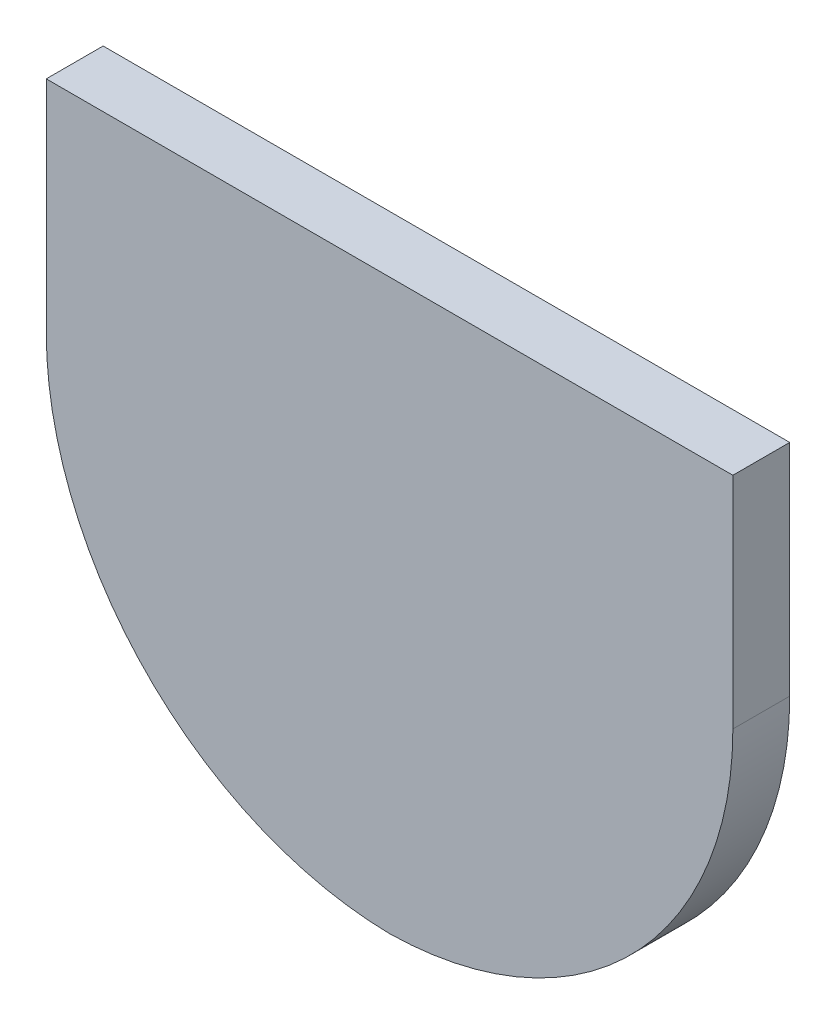
from build123d import *

# Parameters (mm, degrees)
SKETCH_1_W      = 26.56
SKETCH_1_H      = 22
EXTRUDE_1_DEPTH = 2.2
FILLET_1_R      = 13.5


with BuildPart() as part:
    # Эскиз1 → Бобышка-Вытянуть1 (new body)
    with BuildSketch(Plane.XY):
        with Locations((-4.253421702, 0.2)):
            Rectangle(SKETCH_1_W, SKETCH_1_H)
    extrude(amount=EXTRUDE_1_DEPTH)

    # Скругление1
    # the kernel refuses this fillet: 13.5 mm, written as the material it takes off along each edge
    with BuildSketch(Plane(origin=(9.026578298, -10.8, -33.75), x_dir=(0, 1, 0), z_dir=(0, 0, 1)), Plane(origin=(-17.533421702, -10.8, -33.75), x_dir=(1, 0, 0), z_dir=(0, 0, 1))) as fillet_1_piece_1:
        with BuildLine():
            CenterArc((FILLET_1_R, FILLET_1_R), FILLET_1_R, 180, 90)
            Line((0, FILLET_1_R), (0, 0))
            Line((0, 0), (FILLET_1_R, 0))
        make_face()
    extrude(amount=69.7, mode=Mode.SUBTRACT)


solid = part.part
